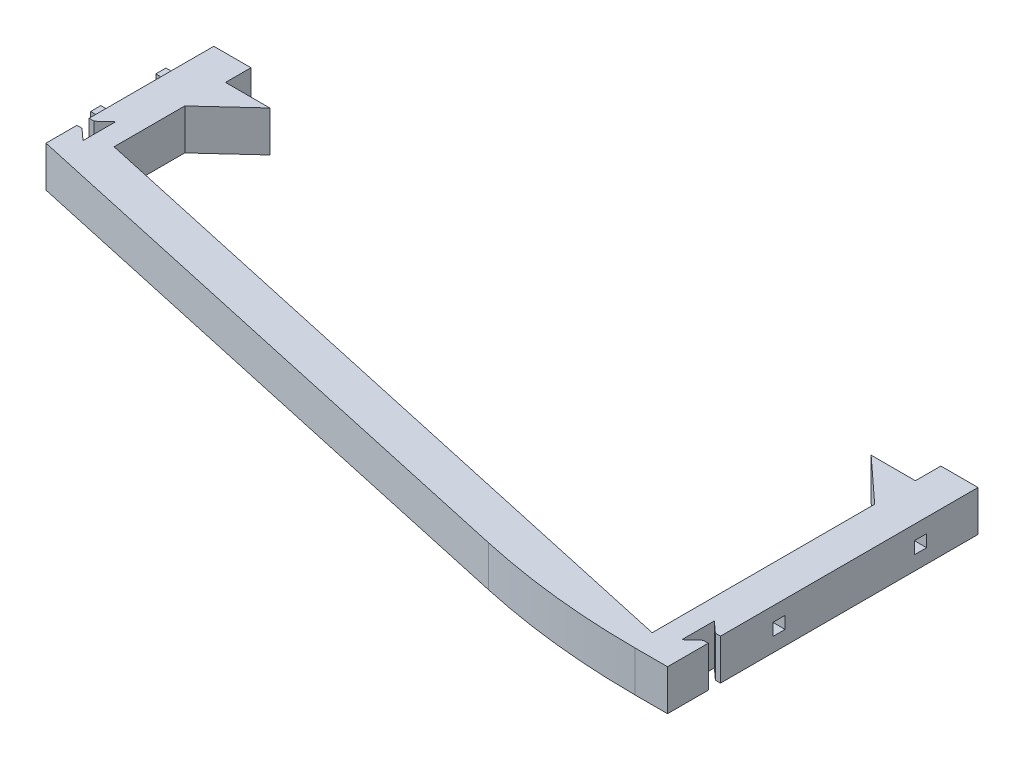
from build123d import *

# Parameters (mm, degrees)
P_IDAT_VYSUNUT_M1_DEPTH  = 8
ODEBRAT_VYSUNUT_M1_DEPTH = 165.210299616
SKICA6_W                 = 16
SKICA6_H                 = 8
P_IDAT_VYSUNUT_M3_DEPTH  = 8
ODEBRAT_VYSUNUT_M4_DEPTH = 165.210299616
SKICA4_W                 = 2.4
SKICA4_H                 = 2.4
ODEBRAT_VYSUNUT_M2_DEPTH = 4.4
SKICA5_W                 = 2
SKICA5_H                 = 2
P_IDAT_VYSUNUT_M2_DEPTH  = 4
ODEBRAT_VYSUNUT_M5_DEPTH = 168.875616157
ODEBRAT_VYSUNUT_M6_DEPTH = 168.875616157
ZAOBLIT1_R               = 150


with BuildPart() as part:
    # Skica1 → Přidat vysunutím1 (new body)
    with BuildSketch(Plane(origin=(0, 0, 0), x_dir=(1, 0, 0), z_dir=(0, 1, 0))):
        Polygon((0, 0), (0, -66), (-150.15, -32.968149881), (-150.15, 0), (-142.85, 0), (-142.85, -26.894750875), (-7.3, -56.714712804), (-7.3, 0), align=None)
    extrude(amount=P_IDAT_VYSUNUT_M1_DEPTH)

    # Skica3 → Odebrat vysunutím1 (cut, through all)
    with BuildSketch(Plane(origin=(0, 8, 0), x_dir=(1, 0, 0), z_dir=(0, 1, 0))):
        Polygon((-1, -50.6), (-3.2, -48.6), (-3.2, -55), (-1, -53), (0, -53), (0, -50.6), align=None)
    extrude(amount=-ODEBRAT_VYSUNUT_M1_DEPTH, mode=Mode.SUBTRACT)

    # Skica6 → Přidat vysunutím3 (add)
    with BuildSketch(Plane(origin=(0, 8, 0), x_dir=(1, 0, 0), z_dir=(0, 1, 0))):
        with Locations((-142.15, -9)):
            Rectangle(SKICA6_W, SKICA6_H)
        with Locations((-8, -9)):
            Rectangle(SKICA6_W, SKICA6_H)
    extrude(amount=-P_IDAT_VYSUNUT_M3_DEPTH)

    # Skica9 → Odebrat vysunutím4 (cut, through all)
    with BuildSketch(Plane.XZ):
        Polygon((-142.85, 13), (-134.15, 13), (-134.15, 5), align=None)
        Polygon((-16, 13), (-7.3, 13), (-16, 5), align=None)
    extrude(amount=-ODEBRAT_VYSUNUT_M4_DEPTH, mode=Mode.SUBTRACT)

    # Skica4 → Odebrat vysunutím2 (cut)
    with BuildSketch(Plane(origin=(0, 0, 0), x_dir=(0, 0, -1), z_dir=(1, 0, 0))):
        with Locations((-39.1, 4)):
            Rectangle(SKICA4_W, SKICA4_H)
        with Locations((-11.3, 4)):
            Rectangle(SKICA4_W, SKICA4_H)
    extrude(amount=-ODEBRAT_VYSUNUT_M2_DEPTH, mode=Mode.SUBTRACT)

    # Skica5 → Přidat vysunutím2 (add)
    with BuildSketch(Plane.ZY.offset(150.15)):
        with Locations((6.4, 4)):
            Rectangle(SKICA5_W, SKICA5_H)
        with Locations((19.2, 4)):
            Rectangle(SKICA5_W, SKICA5_H)
    extrude(amount=P_IDAT_VYSUNUT_M2_DEPTH)

    # Skica10 → Odebrat vysunutím5 (cut, through all)
    with BuildSketch(Plane(origin=(0, 8, 0), x_dir=(1, 0, 0), z_dir=(0, 1, 0))):
        Polygon((-150.15, -26.9), (-149.15, -26.9), (-146.95, -28.9), (-146.95, -22.5), (-149.15, -24.5), (-150.15, -24.5), align=None)
    extrude(amount=-ODEBRAT_VYSUNUT_M5_DEPTH, mode=Mode.SUBTRACT)

    # Skica11 → Odebrat vysunutím6 (cut, through all)
    with BuildSketch(Plane(origin=(0, 8, 0), x_dir=(1, 0, 0), z_dir=(0, 1, 0))):
        Polygon((0, -61), (-22.728063893, -61), (0, -66), align=None)
    extrude(amount=-ODEBRAT_VYSUNUT_M6_DEPTH, mode=Mode.SUBTRACT)

    # Zaoblit1
    zaoblit1_edges = [part.edges().sort_by_distance(p)[0] for p in [
        (-22.728063893, 4, 61),
    ]]
    fillet(zaoblit1_edges, radius=ZAOBLIT1_R)


solid = part.part
